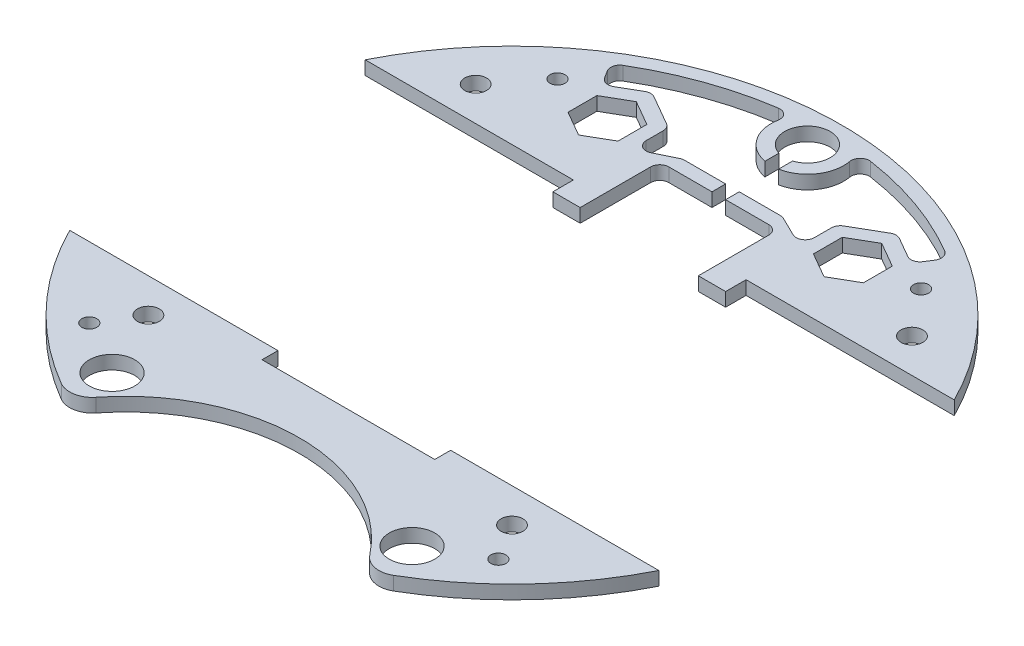
from build123d import *

# Parameters (mm, degrees)
BOSS_EXTRUDE1_DEPTH  = 3
SOLENOID_PLACEMENT_W = 38
SOLENOID_PLACEMENT_H = 64
CUT_EXTRUDE1_DEPTH   = 103.574363269
CUT_EXTRUDE5_DEPTH   = 103.574363269
SKETCH6_R            = 2.4
CUT_EXTRUDE6_DEPTH   = 103.574363269
CUT_EXTRUDE3_DEPTH   = 103.574363269
CUT_EXTRUDE7_DEPTH   = 98.289516393
SKETCH8_R            = 5
CUT_EXTRUDE8_DEPTH   = 98.289516393
CUT_EXTRUDE9_DEPTH   = 98.289516393
SKETCH10_R           = 1.65
CUT_EXTRUDE10_DEPTH  = 10
CUT_EXTRUDE11_DEPTH  = 98.289516393


with BuildPart() as part:
    # Sketch1 → Boss-Extrude1 (new body)
    with BuildSketch(Plane(origin=(0, 0, 0), x_dir=(1, 0, 0), z_dir=(0, 1, 0))):
        with BuildLine():
            ThreePointArc((36.543377003, -62.616544118), (0, 72.5), (-36.543377003, -62.616544118))
            ThreePointArc((-36.543377003, -62.616544118), (-33.085954668, -63.20954405), (-30.089832649, -61.38507948))
            ThreePointArc((-30.089832649, -61.38507948), (0, -46.75), (30.089832649, -61.38507948))
            ThreePointArc((30.089832649, -61.38507948), (33.085954668, -63.20954405), (36.543377003, -62.616544118))
        make_face()
    extrude(amount=BOSS_EXTRUDE1_DEPTH)

    # solenoid placement → Cut-Extrude1 (cut, through all)
    with BuildSketch(Plane(origin=(0, 3, 0), x_dir=(1, 0, 0), z_dir=(0, 1, 0))):
        with Locations((0, -4)):
            Rectangle(SOLENOID_PLACEMENT_W, SOLENOID_PLACEMENT_H)
    extrude(amount=-CUT_EXTRUDE1_DEPTH, mode=Mode.SUBTRACT)

    # Sketch5 → Cut-Extrude5 (cut, through all)
    with BuildSketch(Plane(origin=(0, 3, 0), x_dir=(1, 0, 0), z_dir=(0, 1, 0))):
        Polygon((-21.5, 51.175426481), (-27, 54.350852961), (-32.5, 51.175426481), (-32.5, 44.824573519), (-27, 41.649147039), (-21.5, 44.824573519), align=None)
        Polygon((21.5, 51.175426481), (21.5, 44.824573519), (27, 41.649147039), (32.5, 44.824573519), (32.5, 51.175426481), (27, 54.350852961), align=None)
    extrude(amount=-CUT_EXTRUDE5_DEPTH, mode=Mode.SUBTRACT)

    # Sketch6 → Cut-Extrude6 (cut, through all)
    with BuildSketch(Plane(origin=(0, 3, 0), x_dir=(1, 0, 0), z_dir=(0, 1, 0))):
        with Locations((48, 40)):
            Circle(SKETCH6_R)
        with Locations((-48, 40)):
            Circle(SKETCH6_R)
        with Locations((40, -40)):
            Circle(SKETCH6_R)
        with Locations((-40, -40)):
            Circle(SKETCH6_R)
    extrude(amount=-CUT_EXTRUDE6_DEPTH, mode=Mode.SUBTRACT)

    # Sketch3 → Cut-Extrude3 (cut, through all)
    with BuildSketch(Plane(origin=(0, 3, 0), x_dir=(1, 0, 0), z_dir=(0, 1, 0))):
        Polygon((-19, 28), (-19, 32.5), (-72.5, 32.5), (-72.5, -32.5), (72.5, -32.5), (72.5, 32.5), (19, 32.5), (19, 28), align=None)
    extrude(amount=-CUT_EXTRUDE3_DEPTH, mode=Mode.SUBTRACT)


with BuildPart() as cut_extrude3_piece_1:
    # of the separate pieces the step leaves, piece 1, a body of its own (cut_extrude3_pieces)
    add(part.part.solids().sort_by_distance((64.807406984, 0, -32.5))[0])

    # Sketch7 → Cut-Extrude7 (cut, through all)
    with BuildSketch(Plane(origin=(0, 3, 0), x_dir=(1, 0, 0), z_dir=(0, 1, 0))):
        with BuildLine():
            Line((13, 28), (13, 43.5))
            ThreePointArc((13, 43.5), (12.414213562, 44.914213562), (11, 45.5))
            Line((11, 45.5), (-11, 45.5))
            ThreePointArc((-11, 45.5), (-12.414213562, 44.914213562), (-13, 43.5))
            Line((-13, 43.5), (-13, 28))
            Line((-13, 28), (13, 28))
        make_face()
    extrude(amount=-CUT_EXTRUDE7_DEPTH, mode=Mode.SUBTRACT)

    # Sketch9 → Cut-Extrude9 (cut, through all)
    with BuildSketch(Plane(origin=(0, 3, 0), x_dir=(1, 0, 0), z_dir=(0, 1, 0))):
        with BuildLine():
            Line((1.5, 0), (1.5, 60.230303993))
            ThreePointArc((1.5, 60.230303993), (0, 70), (-1.5, 60.230303993))
            Line((-1.5, 60.230303993), (-1.5, 0))
            ThreePointArc((-1.5, 0), (0, -1.5), (1.5, 0))
        make_face()
    extrude(amount=-CUT_EXTRUDE9_DEPTH, mode=Mode.SUBTRACT)


with BuildPart() as cut_extrude3_piece_2:
    # of the separate pieces the step leaves, piece 2, a body of its own (cut_extrude3_pieces)
    add(part.part.solids().sort_by_distance((-36.543377003, 0, 62.616544118))[0])

    # Sketch8 → Cut-Extrude8 (cut, through all)
    with BuildSketch(Plane(origin=(0, 3, 0), x_dir=(1, 0, 0), z_dir=(0, 1, 0))):
        with Locations((33, -55)):
            Circle(SKETCH8_R)
        with Locations((-33, -55)):
            Circle(SKETCH8_R)
    extrude(amount=-CUT_EXTRUDE8_DEPTH, mode=Mode.SUBTRACT)


with BuildPart() as cut_extrude10_tool:
    # Sketch10 → Cut-Extrude10 (new body)
    with BuildSketch(Plane(origin=(0, 3, 0), x_dir=(1, 0, 0), z_dir=(0, 1, 0))):
        with Locations((45, -48)):
            Circle(SKETCH10_R)
        with Locations((-45, -48)):
            Circle(SKETCH10_R)
        with Locations((40, 50)):
            Circle(SKETCH10_R)
        with Locations((-40, 50)):
            Circle(SKETCH10_R)
    extrude(amount=-CUT_EXTRUDE10_DEPTH)


with BuildPart() as cut_extrude3_piece_1_1:
    add(cut_extrude3_piece_1.part)

    # Cut-Extrude10: cut by cut_extrude10_tool
    add(cut_extrude10_tool.part, mode=Mode.SUBTRACT)

    # Sketch11 → Cut-Extrude11 (cut, through all)
    with BuildSketch(Plane(origin=(0, 3, 0), x_dir=(1, 0, 0), z_dir=(0, 1, 0))):
        with BuildLine():
            Line((-1.5, 48.5), (1.5, 48.5))
            Line((1.5, 48.5), (10.536287302, 48.5))
            ThreePointArc((10.536287302, 48.5), (10.988017035, 48.448317287), (11.416400149, 48.295940249))
            Line((11.416400149, 48.295940249), (15.619887154, 46.235992589))
            ThreePointArc((15.619887154, 46.235992589), (17.558247208, 46.334843316), (18.5, 48.031932838))
            Line((18.5, 48.031932838), (18.5, 51.75277675))
            ThreePointArc((18.5, 51.75277675), (18.767949192, 52.75277675), (19.5, 53.484827557))
            Line((19.5, 53.484827557), (26, 57.237604307))
            ThreePointArc((26, 57.237604307), (27, 57.505553499), (28, 57.237604307))
            Line((28, 57.237604307), (32.336247441, 54.73407068))
            ThreePointArc((32.336247441, 54.73407068), (33.814934269, 54.524251533), (35.026688711, 55.397286461))
            Line((35.026688711, 55.397286461), (36.057344072, 57.027343779))
            ThreePointArc((36.057344072, 57.027343779), (36.311279162, 58.56458095), (35.385181403, 59.817547066))
            ThreePointArc((35.385181403, 59.817547066), (23.193446557, 65.515754112), (10.132084292, 68.757478632))
            ThreePointArc((10.132084292, 68.757478632), (8.40348615, 68.169871795), (7.872410817, 66.423076923))
            ThreePointArc((7.872410817, 66.423076923), (6.139406135, 59.870897514), (0, 57))
            ThreePointArc((0, 57), (-6.139406135, 59.870897514), (-7.872410817, 66.423076923))
            ThreePointArc((-7.872410817, 66.423076923), (-8.40348615, 68.169871795), (-10.132084292, 68.757478632))
            ThreePointArc((-10.132084292, 68.757478632), (-23.193446557, 65.515754112), (-35.385181403, 59.817547066))
            ThreePointArc((-35.385181403, 59.817547066), (-36.311279162, 58.56458095), (-36.057344072, 57.027343779))
            Line((-36.057344072, 57.027343779), (-35.026688711, 55.397286461))
            ThreePointArc((-35.026688711, 55.397286461), (-33.814934269, 54.524251533), (-32.336247441, 54.73407068))
            Line((-32.336247441, 54.73407068), (-28, 57.237604307))
            ThreePointArc((-28, 57.237604307), (-27, 57.505553499), (-26, 57.237604307))
            Line((-26, 57.237604307), (-19.5, 53.484827557))
            ThreePointArc((-19.5, 53.484827557), (-18.767949192, 52.75277675), (-18.5, 51.75277675))
            Line((-18.5, 51.75277675), (-18.5, 48.031932838))
            ThreePointArc((-18.5, 48.031932838), (-17.558247208, 46.334843316), (-15.619887154, 46.235992589))
            Line((-15.619887154, 46.235992589), (-11.416400149, 48.295940249))
            ThreePointArc((-11.416400149, 48.295940249), (-10.988017035, 48.448317287), (-10.536287302, 48.5))
            Line((-10.536287302, 48.5), (-1.5, 48.5))
        make_face()
    extrude(amount=-CUT_EXTRUDE11_DEPTH, mode=Mode.SUBTRACT)


with BuildPart() as cut_extrude3_piece_2_1:
    add(cut_extrude3_piece_2.part)

    # Cut-Extrude10: cut by cut_extrude10_tool
    add(cut_extrude10_tool.part, mode=Mode.SUBTRACT)


solid = Compound([cut_extrude3_piece_1_1.part, cut_extrude3_piece_2_1.part])
